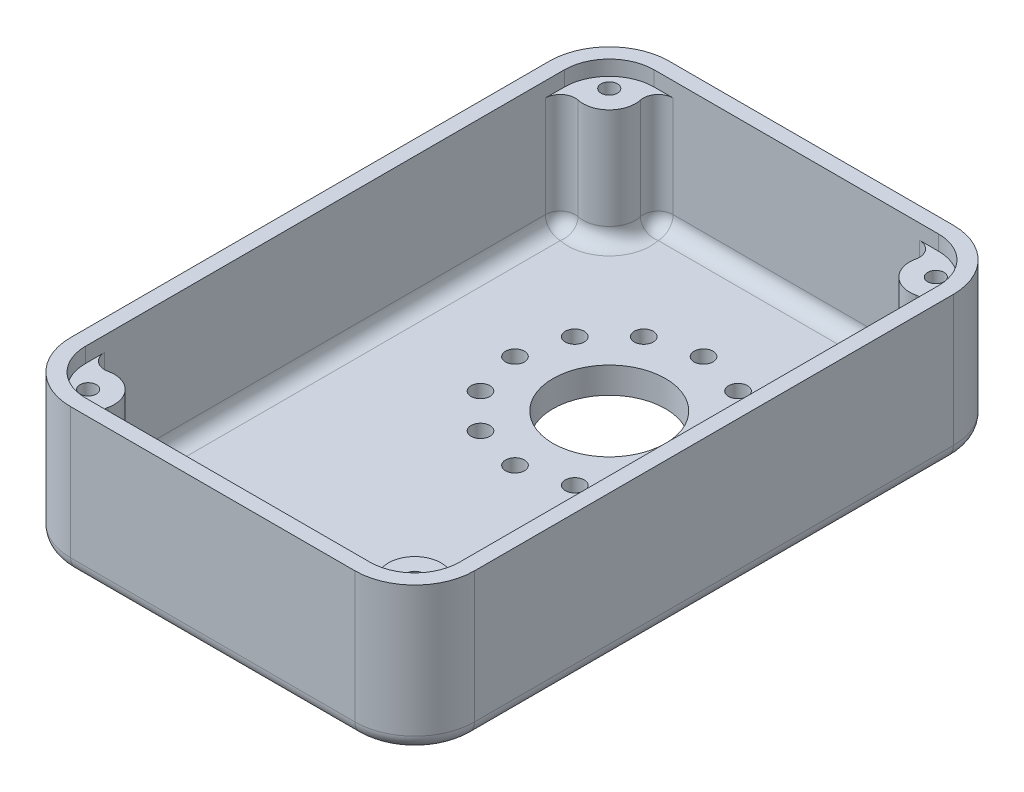
from build123d import *

# Parameters (mm, degrees)
SKETCH1_W            = 11.0236
SKETCH1_H            = 1.905
BOSS_EXTRUDE1_START  = 2.54
SKETCH4_R            = 9.5504
BOSS_EXTRUDE1_DEPTH  = 2.54
M3_CLEARANCE_HOLE1_D = 3.2
BOSS_EXTRUDE4_START  = 22.225
BOSS_EXTRUDE4_DEPTH  = 22.225
FILLET1_R            = 2.54
SKETCH8_R            = 4.445
SKETCH8_R_2          = 1.3890625
BOSS_EXTRUDE5_DEPTH  = 19.685
FILLET3_R            = 2.54
FILLET4_R            = 2.54


with BuildPart() as part:
    # Sketch1 → Revolve1 (revolve)
    with BuildSketch(Plane.XY, mode=Mode.PRIVATE) as revolve1_sk:
        with Locations((-15.0622, -0.9525)):
            Rectangle(SKETCH1_W, SKETCH1_H)
    revolve(revolve1_sk.sketch.rotate(Axis((0, 0, 0), (0, 1, 0)), 270), axis=Axis((0, 0, 0), (0, 1, 0)))

    # Sketch4 → Boss-Extrude1 (add)
    with BuildSketch(Plane(origin=(0, 0, 0), x_dir=(1, 0, 0), z_dir=(0, 1, 0)).offset(BOSS_EXTRUDE1_START)):
        with BuildLine():
            Line((-24.13, -67.31), (24.13, -67.31))
            ThreePointArc((24.13, -67.31), (31.314204897, -64.334204897), (34.29, -57.15))
            Line((34.29, -57.15), (34.29, 24.13))
            ThreePointArc((34.29, 24.13), (31.314204897, 31.314204897), (24.13, 34.29))
            Line((24.13, 34.29), (-24.13, 34.29))
            ThreePointArc((-24.13, 34.29), (-31.314204897, 31.314204897), (-34.29, 24.13))
            Line((-34.29, 24.13), (-34.29, -57.15))
            ThreePointArc((-34.29, -57.15), (-31.314204897, -64.334204897), (-24.13, -67.31))
        make_face()
        Circle(SKETCH4_R, mode=Mode.SUBTRACT)
    extrude(amount=-BOSS_EXTRUDE1_DEPTH)

    # M3 Clearance Hole1 (through all)
    with Locations(Plane(origin=(0, 2.54, 0), x_dir=(1, 0, 0), z_dir=(0, 1, 0))):
        with Locations((-13.858138511, -8.001), (-16.002, 0), (-13.858138511, 8.001), (-8.001, 13.858138511), (0, 16.002), (8.001, 13.858138511), (13.858138511, 8.001), (16.002, 0), (13.858138511, -8.001), (8.001, -13.858138511), (0, -16.002), (-8.001, -13.858138511)):
            Hole(M3_CLEARANCE_HOLE1_D / 2)

    # Sketch6 → Boss-Extrude4 (add)
    with BuildSketch(Plane(origin=(0, 2.54, 0), x_dir=(1, 0, 0), z_dir=(0, 1, 0)).offset(BOSS_EXTRUDE4_START)):
        with BuildLine():
            Line((24.13, 34.29), (-24.13, 34.29))
            ThreePointArc((-24.13, 34.29), (-31.314204897, 31.314204897), (-34.29, 24.13))
            Line((-34.29, 24.13), (-34.29, -57.15))
            ThreePointArc((-34.29, -57.15), (-31.314204897, -64.334204897), (-24.13, -67.31))
            Line((-24.13, -67.31), (24.13, -67.31))
            ThreePointArc((24.13, -67.31), (31.314204897, -64.334204897), (34.29, -57.15))
            Line((34.29, -57.15), (34.29, 24.13))
            ThreePointArc((34.29, 24.13), (31.314204897, 31.314204897), (24.13, 34.29))
        make_face()
        with BuildLine():
            Line((24.13, 31.75), (-24.13, 31.75))
            ThreePointArc((-24.13, 31.75), (-29.518153673, 29.518153673), (-31.75, 24.13))
            Line((-31.75, 24.13), (-31.75, -57.15))
            ThreePointArc((-31.75, -57.15), (-29.518153673, -62.538153673), (-24.13, -64.77))
            Line((-24.13, -64.77), (24.13, -64.77))
            ThreePointArc((24.13, -64.77), (29.518153673, -62.538153673), (31.75, -57.15))
            Line((31.75, -57.15), (31.75, 24.13))
            ThreePointArc((31.75, 24.13), (29.518153673, 29.518153673), (24.13, 31.75))
        make_face(mode=Mode.SUBTRACT)
    extrude(amount=-BOSS_EXTRUDE4_DEPTH)

    # Fillet1
    fillet1_edges = [part.edges().sort_by_distance(p)[0] for p in [
        (-31.314204897, 0, 64.334204897),
        (0, 0, 67.31),
        (31.314204897, 0, 64.334204897),
        (34.29, 0, 16.51),
        (31.314204897, 0, -31.314204897),
        (0, 0, -34.29),
        (-31.314204897, 0, -31.314204897),
        (-34.29, 0, 16.51),
    ]]
    fillet(fillet1_edges, radius=FILLET1_R)

    # Sketch8 → Boss-Extrude5 (add)
    # profile 1 of 4: a face of its own
    with BuildSketch(Plane(origin=(0, 2.54, 0), x_dir=(1, 0, 0), z_dir=(0, 1, 0))):
        with Locations((-27.722102448, -60.742102448)):
            Circle(SKETCH8_R)
        with Locations(Location((-27.722102448, -60.742102448, 0), (0, 0, 270))):
            Circle(SKETCH8_R_2, mode=Mode.SUBTRACT)
    # profile 2 of 4: a face of its own
    with BuildSketch(Plane(origin=(0, 2.54, 0), x_dir=(1, 0, 0), z_dir=(0, 1, 0))):
        with Locations((27.722102448, -60.742102448)):
            Circle(SKETCH8_R)
        with Locations(Location((27.722102448, -60.742102448, 0), (0, 0, 270))):
            Circle(SKETCH8_R_2, mode=Mode.SUBTRACT)
    # profile 3 of 4: a face of its own
    with BuildSketch(Plane(origin=(0, 2.54, 0), x_dir=(1, 0, 0), z_dir=(0, 1, 0))):
        with Locations((27.722102448, 27.722102448)):
            Circle(SKETCH8_R)
        with Locations(Location((27.722102448, 27.722102448, 0), (0, 0, 270))):
            Circle(SKETCH8_R_2, mode=Mode.SUBTRACT)
    # profile 4 of 4: a face of its own
    with BuildSketch(Plane(origin=(0, 2.54, 0), x_dir=(1, 0, 0), z_dir=(0, 1, 0))):
        with Locations((-27.722102448, 27.722102448)):
            Circle(SKETCH8_R)
        with Locations(Location((-27.722102448, 27.722102448, 0), (0, 0, 270))):
            Circle(SKETCH8_R_2, mode=Mode.SUBTRACT)
    extrude(amount=BOSS_EXTRUDE5_DEPTH)

    # Fillet3
    # the kernel refuses this fillet: 2.54 mm, written as the material it adds along each edge
    with BuildSketch(Plane(origin=(25.571770391, 2.54, 64.632359129), x_dir=(-0.5973974080073474, 0, -0.8019453453360166), z_dir=(0, 1, 0)), Plane(origin=(31.612359129, 2.54, -25.571770391), x_dir=(-0.8019453453360167, 0, 0.5973974080073472), z_dir=(0, 1, 0)), Plane(origin=(-25.571770391, 2.54, -31.612359129), x_dir=(0.5973974080073424, 0, 0.8019453453360202), z_dir=(0, 1, 0)), Plane(origin=(-31.612359129, 2.54, 58.591770391), x_dir=(0.8019453453360194, 0, -0.5973974080073438), z_dir=(0, 1, 0))) as fillet3_piece_1:
        with BuildLine():
            CenterArc((4.719009703, 2.313416024), FILLET3_R, 143.316272758, 102.298995101)
            Line((2.682068526, 3.83080544), (2.478374408, 3.982544382))
            ThreePointArc((2.478374408, 3.982544382), (0.547235321, 1.390186295), (-0.228725099, 0.110457363))
            Line((-0.228725099, 0.110457363), (0.104866882, -0.231341602))
            ThreePointArc((0.104866882, -0.231341602), (1.83517044, 0.142521958), (3.565473998, -0.231341602))
            Line((3.565473998, -0.231341602), (3.67034088, 0))
        make_face()
    extrude(amount=19.685)
    with BuildSketch(Plane(origin=(31.612359129, 2.54, 58.591770391), x_dir=(-0.8019453453360176, 0, -0.5973974080073462), z_dir=(0, 1, 0)), Plane(origin=(25.571770391, 2.54, -31.612359129), x_dir=(-0.5973974080073442, 0, 0.801945345336019), z_dir=(0, 1, 0)), Plane(origin=(-31.612359129, 2.54, -25.571770391), x_dir=(0.8019453453360176, 0, 0.5973974080073461), z_dir=(0, 1, 0)), Plane(origin=(-25.571770391, 2.54, 64.632359129), x_dir=(0.5973974080073453, 0, -0.8019453453360182), z_dir=(0, 1, 0))) as fillet3_piece_2:
        with BuildLine():
            CenterArc((4.719009703, -2.313416024), FILLET3_R, 114.384732141, 102.298995101)
            Line((2.682068526, -3.83080544), (2.478374408, -3.982544382))
            ThreePointArc((2.478374408, -3.982544382), (0.547235321, -1.390186295), (-0.228725099, -0.110457363))
            Line((-0.228725099, -0.110457363), (0.104866882, 0.231341602))
            ThreePointArc((0.104866882, 0.231341602), (1.83517044, -0.142521958), (3.565473998, 0.231341602))
            Line((3.565473998, 0.231341602), (3.67034088, 0))
        make_face()
    extrude(amount=19.685)

    # Fillet4
    fillet4_edges = [part.edges().sort_by_distance(p)[0] for p in [
        (0, 2.54, 64.77),
        (-24.579012806, 2.54, -24.579012806),
        (-31.75, 2.54, 16.51),
        (-24.579012806, 2.54, 57.599012806),
        (24.579012806, 2.54, 57.599012806),
        (31.75, 2.54, 16.51),
        (24.579012806, 2.54, -24.579012806),
        (0, 2.54, -31.75),
        (-22.875527809, 2.54, 63.823317877),
        (-30.803317877, 2.54, 55.895527809),
        (-22.875527809, 2.54, -30.803317877),
        (-30.803317877, 2.54, -22.875527809),
        (30.803317877, 2.54, -22.875527809),
        (22.875527809, 2.54, -30.803317877),
        (30.803317877, 2.54, 55.895527809),
        (22.875527809, 2.54, 63.823317877),
    ]]
    fillet(fillet4_edges, radius=FILLET4_R)


solid = part.part
